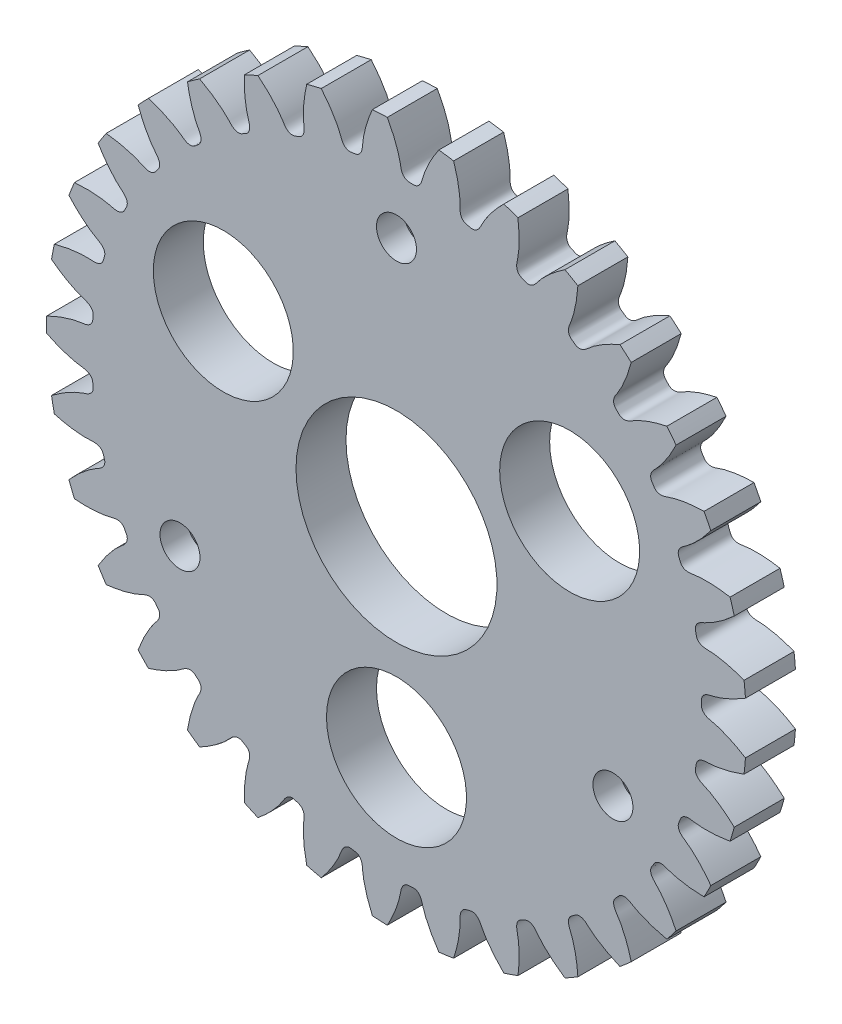
from build123d import *

# Parameters (mm, degrees)
SKETCH_350_W               = 5
SKETCH_350_H               = 34.999999474
CUT_EXTRUDE_636_DEPTH      = 10
PATTERN_CIRCULAR_690_COUNT = 33
SKETCH_1_R                 = 10.05
SKETCH_1_R_2               = 2
SKETCH_1_R_3               = 7
CUT_EXTRUDE_1_DEPTH        = 10
HOLE_WIZARD_1_D            = 4
HOLE_WIZARD_1_CSINK_D      = 8.6
HOLE_WIZARD_1_CSINK_ANGLE  = 90


with BuildPart() as part:
    # Sketch 350 → Revolve 419 (revolve)
    with BuildSketch(Plane(origin=(0, 0, 0), x_dir=(0, 0, -1), z_dir=(1, 0, 0))):
        with Locations((0, 17.499999737)):
            Rectangle(SKETCH_350_W, SKETCH_350_H)
    revolve(axis=Axis((0, 0, 0), (0, 0, -1)))

    # Sketch 464 → Cut-Extrude 636 (cut, symmetric)
    with BuildSketch(Plane.XY):
        with BuildLine():
            ThreePointArc((35.000278387, 2.643950801), (35.099999473, 0), (35.000278387, -2.643950801))
            add(Edge.make_bspline(
                [(35.000278387, -2.643950801), (34.919379243, -2.592895718), (34.81153618, -2.526144261), (34.676522874, -2.444793959), (34.597093547, -2.397573249), (34.518322577, -2.351372471), (34.440219222, -2.306182165), (34.362792647, -2.261992795), (34.286051931, -2.218794752), (34.21000606, -2.176578354), (34.13466393, -2.13533385), (34.060034346, -2.095051414), (33.986126022, -2.055721155), (33.912947578, -2.017333109), (33.840507544, -1.979877246), (33.768814354, -1.943343466), (33.697876349, -1.907721605), (33.627701777, -1.873001429), (33.558298791, -1.839172642), (33.489675446, -1.80622488), (33.421839705, -1.774147719), (33.354799433, -1.742930669), (33.288562398, -1.712563179), (33.223136273, -1.683034634), (33.15852863, -1.654334361), (33.094746947, -1.626451625), (33.0317986, -1.599375634), (32.969690867, -1.573095535), (32.908430929, -1.54760042), (32.848025865, -1.52287932), (32.788482654, -1.498921214), (32.729808175, -1.475715024), (32.672009205, -1.453249618), (32.615092422, -1.43151381), (32.559064398, -1.41049636), (32.503931608, -1.390185979), (32.44970042, -1.370571323), (32.396377102, -1.351641001), (32.343967817, -1.33338357), (32.292478624, -1.315787539), (32.24191548, -1.29884137), (32.192284237, -1.282533476), (32.143590639, -1.266852226), (32.09584033, -1.251785942), (32.049038845, -1.237322901), (32.003191615, -1.223451338), (31.958303964, -1.210159443), (31.914381109, -1.197435366), (31.871428162, -1.185267214), (31.829450128, -1.173643054), (31.788451902, -1.162550915), (31.748438274, -1.151978787), (31.709413927, -1.141914614), (31.67138343, -1.132346336), (31.634351258, -1.123261742), (31.598321733, -1.114648992), (31.563299225, -1.106494763), (31.529287433, -1.098790863), (31.496291945, -1.091510677), (31.400167004, -1.071018636), (31.295421376, -1.049341273), (31.185055463, -1.015418367), (31.129485183, -0.996358873), (31.074923977, -0.975315074), (31.021150849, -0.952030296), (30.96793481, -0.926096542), (30.915033605, -0.896984029), (30.862222777, -0.863984388), (30.809344421, -0.826169903), (30.756396564, -0.782351481), (30.703680733, -0.731067017), (30.652021444, -0.670646826), (30.603040713, -0.599439538), (30.559383817, -0.516277028), (30.524699783, -0.421229247), (30.504118284, -0.321634877), (30.495725613, -0.179972463), (30.502995594, 0), (30.495725613, 0.179972463), (30.504118284, 0.321634877), (30.524699783, 0.421229247), (30.559383817, 0.516277028), (30.603040713, 0.599439538), (30.652021444, 0.670646826), (30.703680733, 0.731067017), (30.756396564, 0.782351481), (30.809344421, 0.826169903), (30.862222777, 0.863984388), (30.915033605, 0.896984029), (30.96793481, 0.926096542), (31.021150849, 0.952030296), (31.074923977, 0.975315074), (31.129485183, 0.996358873), (31.185055463, 1.015418367), (31.295421376, 1.049341273), (31.400167004, 1.071018636), (31.496291945, 1.091510677), (31.529287433, 1.098790863), (31.563299225, 1.106494763), (31.598321733, 1.114648992), (31.634351258, 1.123261742), (31.67138343, 1.132346336), (31.709413927, 1.141914614), (31.748438274, 1.151978787), (31.788451902, 1.162550915), (31.829450128, 1.173643054), (31.871428162, 1.185267214), (31.914381109, 1.197435366), (31.958303964, 1.210159443), (32.003191615, 1.223451338), (32.049038845, 1.237322901), (32.09584033, 1.251785942), (32.143590639, 1.266852226), (32.192284237, 1.282533476), (32.24191548, 1.29884137), (32.292478624, 1.315787539), (32.343967817, 1.33338357), (32.396377102, 1.351641001), (32.44970042, 1.370571323), (32.503931608, 1.390185979), (32.559064398, 1.41049636), (32.615092422, 1.43151381), (32.672009205, 1.453249618), (32.729808175, 1.475715024), (32.788482654, 1.498921214), (32.848025865, 1.52287932), (32.908430929, 1.54760042), (32.969690867, 1.573095535), (33.0317986, 1.599375634), (33.094746947, 1.626451625), (33.15852863, 1.654334361), (33.223136273, 1.683034634), (33.288562398, 1.712563179), (33.354799433, 1.742930669), (33.421839705, 1.774147719), (33.489675446, 1.80622488), (33.558298791, 1.839172642), (33.627701777, 1.873001429), (33.697876349, 1.907721605), (33.768814354, 1.943343466), (33.840507544, 1.979877246), (33.912947578, 2.017333109), (33.986126022, 2.055721155), (34.060034346, 2.095051414), (34.13466393, 2.13533385), (34.21000606, 2.176578354), (34.286051931, 2.218794752), (34.362792647, 2.261992795), (34.440219222, 2.306182165), (34.518322577, 2.351372471), (34.597093547, 2.397573249), (34.676522874, 2.444793959), (34.81153618, 2.526144261), (34.919379243, 2.592895718), (35.000278387, 2.643950801)],
                knots=[0, 0, 0, 0, 0.026001539, 0.034472044, 0.042844201, 0.051118007, 0.059293464, 0.067370572, 0.07534933, 0.083229738, 0.091011797, 0.098695506, 0.106280865, 0.113767875, 0.121156536, 0.128446847, 0.135638808, 0.142732419, 0.149727682, 0.156624594, 0.163423157, 0.17012337, 0.176725234, 0.183228748, 0.189633913, 0.195940728, 0.202149193, 0.208259309, 0.214271075, 0.220184492, 0.225999559, 0.231716277, 0.237334645, 0.242854663, 0.248276332, 0.253599651, 0.25882462, 0.26395124, 0.268979511, 0.273909432, 0.278741003, 0.283474225, 0.288109097, 0.292645619, 0.297083792, 0.301423616, 0.30566509, 0.309808214, 0.313852988, 0.317799413, 0.321647489, 0.325397215, 0.329048591, 0.332601618, 0.336056295, 0.339412623, 0.342670601, 0.345830229, 0.348891508, 0.351854437, 0.372547323, 0.377915516, 0.383227751, 0.388512948, 0.39380625, 0.399150463, 0.40459773, 0.410211317, 0.416067186, 0.422254649, 0.42887466, 0.436033334, 0.443827266, 0.452317604, 0.461494215, 0.471241684, 0.479840234, 0.5, 0.520159766, 0.528758316, 0.538505785, 0.547682396, 0.556172734, 0.563966666, 0.57112534, 0.577745351, 0.583932814, 0.589788683, 0.59540227, 0.600849537, 0.60619375, 0.611487052, 0.616772249, 0.622084484, 0.627452677, 0.648145563, 0.651108492, 0.654169771, 0.657329399, 0.660587377, 0.663943705, 0.667398382, 0.670951409, 0.674602785, 0.678352511, 0.682200587, 0.686147012, 0.690191786, 0.69433491, 0.698576384, 0.702916208, 0.707354381, 0.711890903, 0.716525775, 0.721258997, 0.726090568, 0.731020489, 0.73604876, 0.74117538, 0.746400349, 0.751723668, 0.757145337, 0.762665355, 0.768283723, 0.774000441, 0.779815508, 0.785728925, 0.791740691, 0.797850807, 0.804059272, 0.810366087, 0.816771252, 0.823274766, 0.82987663, 0.836576843, 0.843375406, 0.850272318, 0.857267581, 0.864361192, 0.871553153, 0.878843464, 0.886232125, 0.893719135, 0.901304494, 0.908988203, 0.916770262, 0.92465067, 0.932629428, 0.940706536, 0.948881993, 0.957155799, 0.965527956, 0.973998461, 1, 1, 1, 1], degree=3))
        make_face()
    cut_extrude_636 = extrude(amount=CUT_EXTRUDE_636_DEPTH, both=True, mode=Mode.SUBTRACT)

    # Pattern Circular 690: Cut-Extrude 636 ×33 about axis
    pattern_circular_690_axis = Axis((0, 0, 55), (0, 0, -1))
    for i in range(1, PATTERN_CIRCULAR_690_COUNT):
        add(cut_extrude_636.rotate(pattern_circular_690_axis, i * 360 / PATTERN_CIRCULAR_690_COUNT), mode=Mode.SUBTRACT)

    # 草图1 → 切除-拉伸1 (cut)
    with BuildSketch(Plane(origin=(0, 0, -2.5), x_dir=(-1, 0, 0), z_dir=(0, 0, -1))):
        Circle(SKETCH_1_R)
        with Locations((0, 25)):
            Circle(SKETCH_1_R_2)
        with Locations((21.650635095, -12.5)):
            Circle(SKETCH_1_R_2)
        with Locations((-21.650635095, -12.5)):
            Circle(SKETCH_1_R_2)
        with Locations((17.320508076, 10)):
            Circle(SKETCH_1_R_3)
        with Locations((0, -20)):
            Circle(SKETCH_1_R_3)
        with Locations((-17.320508076, 10)):
            Circle(SKETCH_1_R_3)
    extrude(amount=-CUT_EXTRUDE_1_DEPTH, mode=Mode.SUBTRACT)

    # 打孔尺寸(%根据十字)槽沉头木螺钉的类型1 (through all)
    with Locations(Plane(origin=(0, 25, -2.5), x_dir=(-1, 0, 0), z_dir=(0, 0, -1))):
        with Locations((0, 0), (21.650635095, -37.5), (-21.650635095, -37.5)):
            CounterSinkHole(HOLE_WIZARD_1_D / 2, HOLE_WIZARD_1_CSINK_D / 2, counter_sink_angle=HOLE_WIZARD_1_CSINK_ANGLE)


solid = part.part
